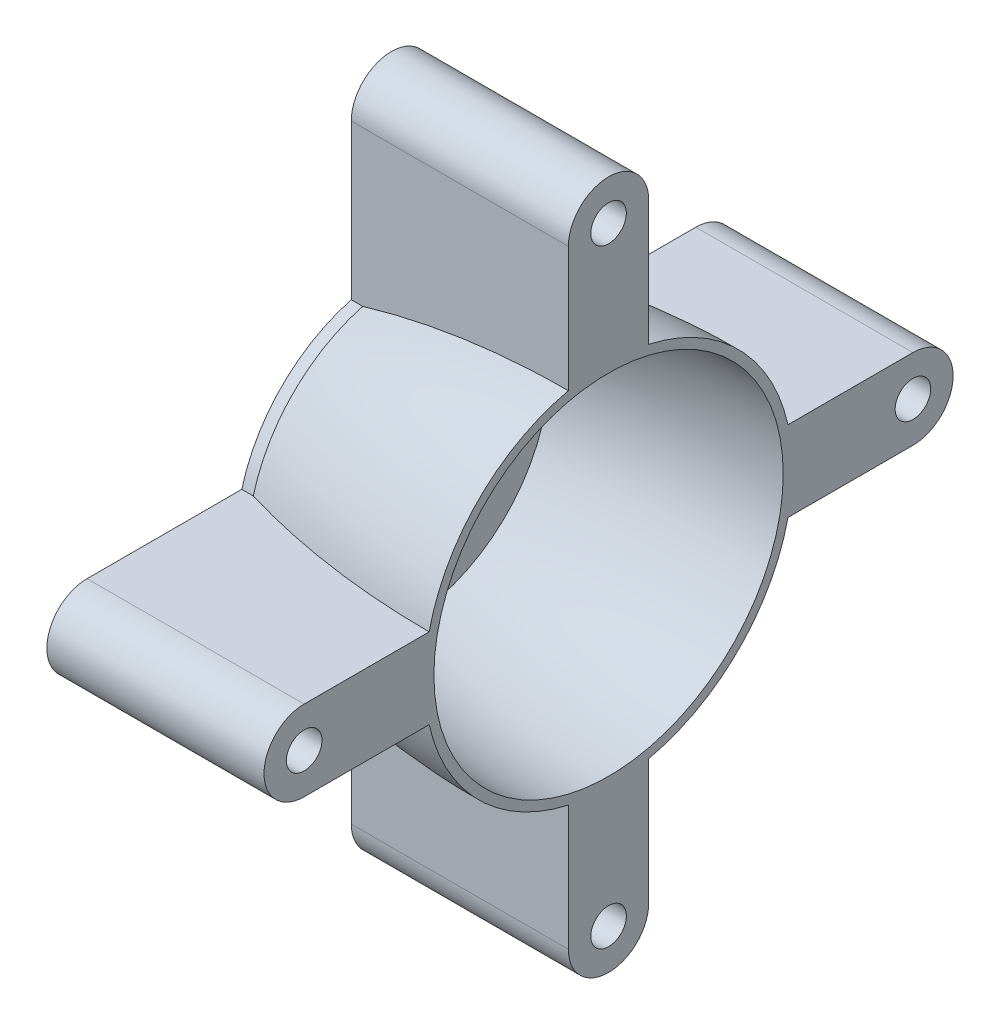
from build123d import *

# Parameters (mm, degrees)
BOSS_EXTRUDE1_DEPTH = 18.916428128
SKETCH2_R           = 1.25
CUT_EXTRUDE1_DEPTH  = 47.475699972
SKETCH4_R           = 1.55
CUT_EXTRUDE2_DEPTH  = 47.475699972


# Read off the part's stored shape, not the designer's step: Roller coating 12, Roller core 12 coated
with BuildPart() as part:
    # Roller coating 12 outline → Roller coating 12 (revolve)
    with BuildSketch(Plane.YX):
        with BuildLine():
            ThreePointArc((12.7, -17.916428128), (15.217989764, 0), (12.7, 17.916428128))
            Line((12.7, 17.916428128), (8, 17.916428128))
            Line((8, 17.916428128), (8, 17.416428128))
            Line((8, 17.416428128), (12.322080058, 17.416428128))
            ThreePointArc((12.322080058, 17.416428128), (14.717989764, 0), (12.322080058, -17.416428128))
            Line((12.322080058, -17.416428128), (8, -17.416428128))
            Line((8, -17.416428128), (8, -17.916428128))
            Line((8, -17.916428128), (12.7, -17.916428128))
        make_face()
    revolve(axis=Axis((0, 0, 0), (1, 0, 0)))


with BuildPart() as body_2:
    # Roller core 12 coated outline → Roller core 12 coated (revolve)
    with BuildSketch(Plane.YX):
        with BuildLine():
            Line((1.25, 17.416428128), (1.25, -17.416428128))
            Line((1.25, -17.416428128), (12.322080058, -17.416428128))
            ThreePointArc((12.322080058, -17.416428128), (14.717989764, 0), (12.322080058, 17.416428128))
            Line((12.322080058, 17.416428128), (1.25, 17.416428128))
        make_face()
    revolve(axis=Axis((0, 0, 0), (1, 0, 0)))


with BuildPart() as part_1:
    add(part.part)

    # Combine1: union body 2
    add(body_2.part)


with BuildPart() as body_2_2:
    # Sketch1 → Revolve1 (revolve)
    with BuildSketch(Plane.XY, mode=Mode.PRIVATE) as revolve1_sk:
        with BuildLine():
            Line((0, 0), (0, 15.217989764))
            Line((0, 15.217989764), (0, 16.017989764))
            ThreePointArc((0, 16.017989764), (-9.046251562, 15.385414232), (-17.916428128, 13.5))
            Line((-17.916428128, 13.5), (-18.916428128, 13.5))
            Line((-18.916428128, 13.5), (-18.916428128, 0))
            Line((-18.916428128, 0), (0, 0))
        make_face()
    revolve(revolve1_sk.sketch.rotate(Axis((-18.916428128, 0, 0), (1, 0, 0)), 270), axis=Axis((-18.916428128, 0, 0), (1, 0, 0)))

    # Sketch3 → Boss-Extrude1 (add)
    with BuildSketch(Plane(origin=(-18.916428128, 0, 0), x_dir=(0, 0, -1), z_dir=(1, 0, 0))):
        with BuildLine():
            Line((-3.5, 26.517989764), (-3.5, 13.03840481))
            ThreePointArc((-3.5, 13.03840481), (-9.545941546, 9.545941546), (-13.03840481, 3.5))
            Line((-13.03840481, 3.5), (-26.517989764, 3.5))
            ThreePointArc((-26.517989764, 3.5), (-30.017989764, 0), (-26.517989764, -3.5))
            Line((-26.517989764, -3.5), (-13.03840481, -3.5))
            ThreePointArc((-13.03840481, -3.5), (-9.545941546, -9.545941546), (-3.5, -13.03840481))
            Line((-3.5, -13.03840481), (-3.5, -26.517989764))
            ThreePointArc((-3.5, -26.517989764), (0, -30.017989764), (3.5, -26.517989764))
            Line((3.5, -26.517989764), (3.5, -13.03840481))
            ThreePointArc((3.5, -13.03840481), (9.545941546, -9.545941546), (13.03840481, -3.5))
            Line((13.03840481, -3.5), (26.517989764, -3.5))
            ThreePointArc((26.517989764, -3.5), (30.017989764, 0), (26.517989764, 3.5))
            Line((26.517989764, 3.5), (13.03840481, 3.5))
            ThreePointArc((13.03840481, 3.5), (9.545941546, 9.545941546), (3.5, 13.03840481))
            Line((3.5, 13.03840481), (3.5, 26.517989764))
            ThreePointArc((3.5, 26.517989764), (0, 30.017989764), (-3.5, 26.517989764))
        make_face()
    extrude(amount=BOSS_EXTRUDE1_DEPTH)

    # Combine2: cut part
    add(part_1.part, mode=Mode.SUBTRACT)

    # Sketch2 → Cut-Extrude1 (cut, through all)
    with BuildSketch(Plane(origin=(0, 0, 0), x_dir=(0, 0, -1), z_dir=(1, 0, 0))):
        Circle(SKETCH2_R)
    extrude(amount=-CUT_EXTRUDE1_DEPTH, mode=Mode.SUBTRACT)

    # Sketch4 → Cut-Extrude2 (cut, through all)
    with BuildSketch(Plane(origin=(0, 0, 0), x_dir=(0, 0, -1), z_dir=(1, 0, 0))):
        with Locations((0, -26.517989764)):
            Circle(SKETCH4_R)
        with Locations((-26.517989764, 0)):
            Circle(SKETCH4_R)
        with Locations((0, 26.517989764)):
            Circle(SKETCH4_R)
        with Locations((26.517989764, 0)):
            Circle(SKETCH4_R)
    extrude(amount=-CUT_EXTRUDE2_DEPTH, mode=Mode.SUBTRACT)


solid = body_2_2.part
